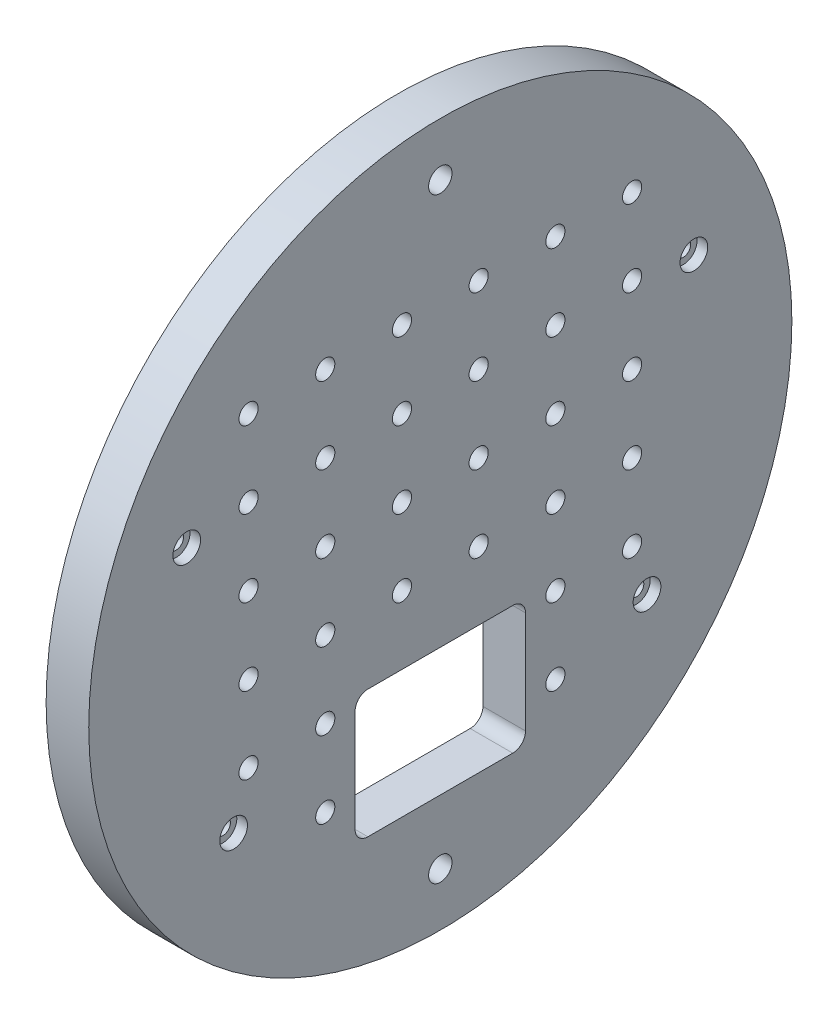
from build123d import *

# Parameters (mm, degrees)
SKETCH_1_R                  = 82.5
EXTRUDE_1_DEPTH             = 10
HOLE_WIZARD_508_D           = 3.5
HOLE_WIZARD_508_CBORE_D     = 6.5
HOLE_WIZARD_508_CBORE_DEPTH = 2.5
SKETCH_5_R                  = 2.75
CUT_EXTRUDE_867_DEPTH       = 118.100384286
CUT_EXTRUDE_1567_REACH      = 119.1
CUT_EXTRUDE_1_REACH         = 119.1
SKETCH_10_R                 = 2.25
PATTERN_LINEAR_1_COUNT      = 6
PATTERN_LINEAR_1_PITCH      = 18
PATTERN_LINEAR_1_COUNT_DIR2 = 6
PATTERN_LINEAR_1_PITCH_DIR2 = 18


with BuildPart() as part:
    # 草圖1 → 填料-伸長1 (new body)
    with BuildSketch(Plane(origin=(0, 0, 0), x_dir=(0, 0, -1), z_dir=(1, 0, 0))):
        Circle(SKETCH_1_R)
    extrude(amount=EXTRUDE_1_DEPTH)

    # Hole Wizard 508 (through all)
    with Locations(Plane(origin=(10, 25, -59.5), x_dir=(0, 0, 1), z_dir=(1, 0, 0))):
        with Locations((0, 0), (119, 0), (108, 63.5), (11, 63.5)):
            CounterBoreHole(HOLE_WIZARD_508_D / 2, HOLE_WIZARD_508_CBORE_D / 2, HOLE_WIZARD_508_CBORE_DEPTH)

    # 草圖5 → Cut-Extrude 867 (cut, through all)
    with BuildSketch(Plane.ZY.offset(-10)):
        with Locations((0, 70)):
            Circle(SKETCH_5_R)
        with Locations((0, -70)):
            Circle(SKETCH_5_R)
    extrude(amount=CUT_EXTRUDE_867_DEPTH, mode=Mode.SUBTRACT)

    # 草圖7 → Cut-Extrude 1567 (cut, up to next)
    with BuildSketch(Plane(origin=(10, 0, 0), x_dir=(0, 0, -1), z_dir=(1, 0, 0)), mode=Mode.PRIVATE) as cut_extrude_1567_sk1:
        with BuildLine():
            Line((-17, -25), (17, -25))
            ThreePointArc((17, -25), (19.121320344, -25.878679656), (20, -28))
            Line((20, -28), (20, -52))
            ThreePointArc((20, -52), (19.121320344, -54.121320344), (17, -55))
            Line((17, -55), (-17, -55))
            ThreePointArc((-17, -55), (-19.121320344, -54.121320344), (-20, -52))
            Line((-20, -52), (-20, -28))
            ThreePointArc((-20, -28), (-19.121320344, -25.878679656), (-17, -25))
        make_face()
    cut_extrude_1567_tool1 = extrude(cut_extrude_1567_sk1.sketch, amount=-CUT_EXTRUDE_1567_REACH, mode=Mode.PRIVATE) & part.part
    add(cut_extrude_1567_tool1.solids().sort_by_distance((10, -40, 0))[0], mode=Mode.SUBTRACT)

    # 草圖10 → 除料-伸長1 (cut, up to next)
    with BuildSketch(Plane(origin=(10, 0, 0), x_dir=(0, 0, -1), z_dir=(1, 0, 0)), mode=Mode.PRIVATE) as cut_extrude_1_sk1:
        with Locations((45, 45)):
            Circle(SKETCH_10_R)
    cut_extrude_1_tool1 = extrude(cut_extrude_1_sk1.sketch, amount=-CUT_EXTRUDE_1_REACH, mode=Mode.PRIVATE) & part.part
    cut_extrude_1 = cut_extrude_1_tool1.solids().sort_by_distance((10, 45, -45))[0]
    add(cut_extrude_1, mode=Mode.SUBTRACT)

    # 直線複製排列1: Cut-Extrude 1 6 × 6, 6 skipped
    with Locations(*[(0, -j * PATTERN_LINEAR_1_PITCH_DIR2, i * PATTERN_LINEAR_1_PITCH) for i in range(PATTERN_LINEAR_1_COUNT) for j in range(PATTERN_LINEAR_1_COUNT_DIR2) if (i, j) not in ((0, 0), (0, 5), (2, 4), (2, 5), (3, 4), (3, 5), (5, 5))]):
        add(cut_extrude_1, mode=Mode.SUBTRACT)


solid = part.part
